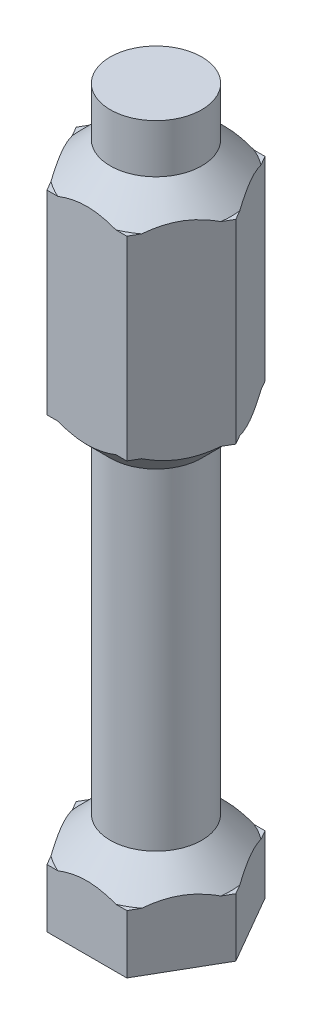
from build123d import *

# Parameters (mm, degrees)
BOSS_EXTRUDE1_DEPTH = 3
SKETCH2_R           = 2.35
BOSS_EXTRUDE2_DEPTH = 20
BOSS_EXTRUDE3_START = 23
BOSS_EXTRUDE3_DEPTH = 10
BOSS_EXTRUDE4_START = 30
SKETCH2_2_R         = 2.35
BOSS_EXTRUDE4_DEPTH = 4
CHAMFER1_SIZE       = 1.5


with BuildPart() as part:
    # Sketch1 → Boss-Extrude1 (new body)
    with BuildSketch(Plane(origin=(0, 0, 0), x_dir=(1, 0, 0), z_dir=(0, 1, 0))):
        Polygon((2.049593456, -3.55), (4.099186911, 0), (2.049593456, 3.55), (-2.049593456, 3.55), (-4.099186911, 0), (-2.049593456, -3.55), align=None)
    extrude(amount=BOSS_EXTRUDE1_DEPTH)

    # Sketch2 → Boss-Extrude2 (add)
    with BuildSketch(Plane(origin=(0, 3, 0), x_dir=(1, 0, 0), z_dir=(0, 1, 0))):
        with Locations(Location((0, 0, 0), (0, 0, 270))):
            Circle(SKETCH2_R)
    extrude(amount=BOSS_EXTRUDE2_DEPTH)

    # Sketch1<2> → Boss-Extrude3 (add)
    with BuildSketch(Plane(origin=(0, 0, 0), x_dir=(1, 0, 0), z_dir=(0, 1, 0)).offset(BOSS_EXTRUDE3_START)):
        Polygon((2.049593456, -3.55), (4.099186911, 0), (2.049593456, 3.55), (-2.049593456, 3.55), (-4.099186911, 0), (-2.049593456, -3.55), align=None)
    extrude(amount=BOSS_EXTRUDE3_DEPTH)

    # Sketch2<2> → Boss-Extrude4 (add)
    with BuildSketch(Plane(origin=(0, 3, 0), x_dir=(1, 0, 0), z_dir=(0, 1, 0)).offset(BOSS_EXTRUDE4_START)):
        with Locations(Location((0, 0, 0), (0, 0, 270))):
            Circle(SKETCH2_2_R)
    extrude(amount=BOSS_EXTRUDE4_DEPTH)

    # Chamfer1
    # the kernel refuses this chamfer: 1.5 mm, written as the material it adds along each edge
    with BuildSketch(Plane(origin=(0, 3, 0), x_dir=(0, 0, 1), z_dir=(-1, 0, 0))) as chamfer1_piece_1_section:
        Polygon((2.35, CHAMFER1_SIZE), (2.35 + CHAMFER1_SIZE, 0), (2.35, 0), align=None)
    chamfer1_piece_1 = revolve(axis=Axis((0, 3, 0), (0, 1, 0)), mode=Mode.PRIVATE)
    chamfer1_piece_1 = split(chamfer1_piece_1, bisect_by=Plane(origin=(4.408223306, 3.730355649, -0.535266737), z_dir=(-0.8660254037844387, 0, -0.5)), keep=Keep.TOP, mode=Mode.PRIVATE)
    chamfer1_piece_1 = split(chamfer1_piece_1, bisect_by=Plane(origin=(0, 3.730355649, 3.55), z_dir=(0, 0, -1)), keep=Keep.TOP, mode=Mode.PRIVATE)
    chamfer1_piece_1 = split(chamfer1_piece_1, bisect_by=Plane(origin=(1.740557061, 3.730355649, -4.085266737), z_dir=(-0.8660254037844387, 0, 0.5000000000000003)), keep=Keep.TOP, mode=Mode.PRIVATE)
    chamfer1_piece_1 = split(chamfer1_piece_1, bisect_by=Plane(origin=(-4.408223306, 3.730355649, -0.535266737), z_dir=(0.8660254037844387, 0, -0.5000000000000003)), keep=Keep.TOP, mode=Mode.PRIVATE)
    chamfer1_piece_1 = split(chamfer1_piece_1, bisect_by=Plane(origin=(0, 3.730355649, -3.55), z_dir=(0, 0, 1)), keep=Keep.TOP, mode=Mode.PRIVATE)
    chamfer1_piece_1 = split(chamfer1_piece_1, bisect_by=Plane(origin=(-1.740557061, 3.730355649, -4.085266737), z_dir=(0.8660254037844386, 0, 0.5000000000000002)), keep=Keep.TOP, mode=Mode.PRIVATE)
    add(chamfer1_piece_1)
    with BuildSketch(Plane(origin=(0, 23, 0), x_dir=(0, 0, 1), z_dir=(-1, 0, 0))) as chamfer1_piece_2_section:
        Polygon((2.35 + CHAMFER1_SIZE, 0), (2.35, -CHAMFER1_SIZE), (2.35, 0), align=None)
    chamfer1_piece_2 = revolve(axis=Axis((0, 23, 0), (0, 1, 0)), mode=Mode.PRIVATE)
    chamfer1_piece_2 = split(chamfer1_piece_2, bisect_by=Plane(origin=(4.408223304, 22.269644356, -0.535266733), z_dir=(-0.8660254037844387, 0, -0.5)), keep=Keep.TOP, mode=Mode.PRIVATE)
    chamfer1_piece_2 = split(chamfer1_piece_2, bisect_by=Plane(origin=(0, 22.269644356, 3.55), z_dir=(0, 0, -1)), keep=Keep.TOP, mode=Mode.PRIVATE)
    chamfer1_piece_2 = split(chamfer1_piece_2, bisect_by=Plane(origin=(1.740557063, 22.269644356, -4.085266733), z_dir=(-0.8660254037844387, 0, 0.5000000000000003)), keep=Keep.TOP, mode=Mode.PRIVATE)
    chamfer1_piece_2 = split(chamfer1_piece_2, bisect_by=Plane(origin=(-4.408223304, 22.269644356, -0.535266733), z_dir=(0.8660254037844387, 0, -0.5000000000000003)), keep=Keep.TOP, mode=Mode.PRIVATE)
    chamfer1_piece_2 = split(chamfer1_piece_2, bisect_by=Plane(origin=(0, 22.269644356, -3.55), z_dir=(0, 0, 1)), keep=Keep.TOP, mode=Mode.PRIVATE)
    chamfer1_piece_2 = split(chamfer1_piece_2, bisect_by=Plane(origin=(-1.740557063, 22.269644356, -4.085266733), z_dir=(0.8660254037844386, 0, 0.5000000000000002)), keep=Keep.TOP, mode=Mode.PRIVATE)
    add(chamfer1_piece_2)
    with BuildSketch(Plane(origin=(0, 33, 0), x_dir=(0, 0, 1), z_dir=(-1, 0, 0))) as chamfer1_piece_3_section:
        Polygon((2.35 + CHAMFER1_SIZE, 0), (2.35, CHAMFER1_SIZE), (2.35, 0), align=None)
    chamfer1_piece_3 = revolve(axis=Axis((0, 33, 0), (0, 1, 0)), mode=Mode.PRIVATE)
    chamfer1_piece_3 = split(chamfer1_piece_3, bisect_by=Plane(origin=(4.408223304, 33.730355644, -0.535266733), z_dir=(-0.8660254037844387, 0, -0.5)), keep=Keep.TOP, mode=Mode.PRIVATE)
    chamfer1_piece_3 = split(chamfer1_piece_3, bisect_by=Plane(origin=(0, 33.730355644, 3.55), z_dir=(0, 0, -1)), keep=Keep.TOP, mode=Mode.PRIVATE)
    chamfer1_piece_3 = split(chamfer1_piece_3, bisect_by=Plane(origin=(1.740557063, 33.730355644, -4.085266733), z_dir=(-0.8660254037844387, 0, 0.5000000000000003)), keep=Keep.TOP, mode=Mode.PRIVATE)
    chamfer1_piece_3 = split(chamfer1_piece_3, bisect_by=Plane(origin=(-4.408223304, 33.730355644, -0.535266733), z_dir=(0.8660254037844387, 0, -0.5000000000000003)), keep=Keep.TOP, mode=Mode.PRIVATE)
    chamfer1_piece_3 = split(chamfer1_piece_3, bisect_by=Plane(origin=(0, 33.730355644, -3.55), z_dir=(0, 0, 1)), keep=Keep.TOP, mode=Mode.PRIVATE)
    chamfer1_piece_3 = split(chamfer1_piece_3, bisect_by=Plane(origin=(-1.740557063, 33.730355644, -4.085266733), z_dir=(0.8660254037844386, 0, 0.5000000000000002)), keep=Keep.TOP, mode=Mode.PRIVATE)
    add(chamfer1_piece_3)


solid = part.part
